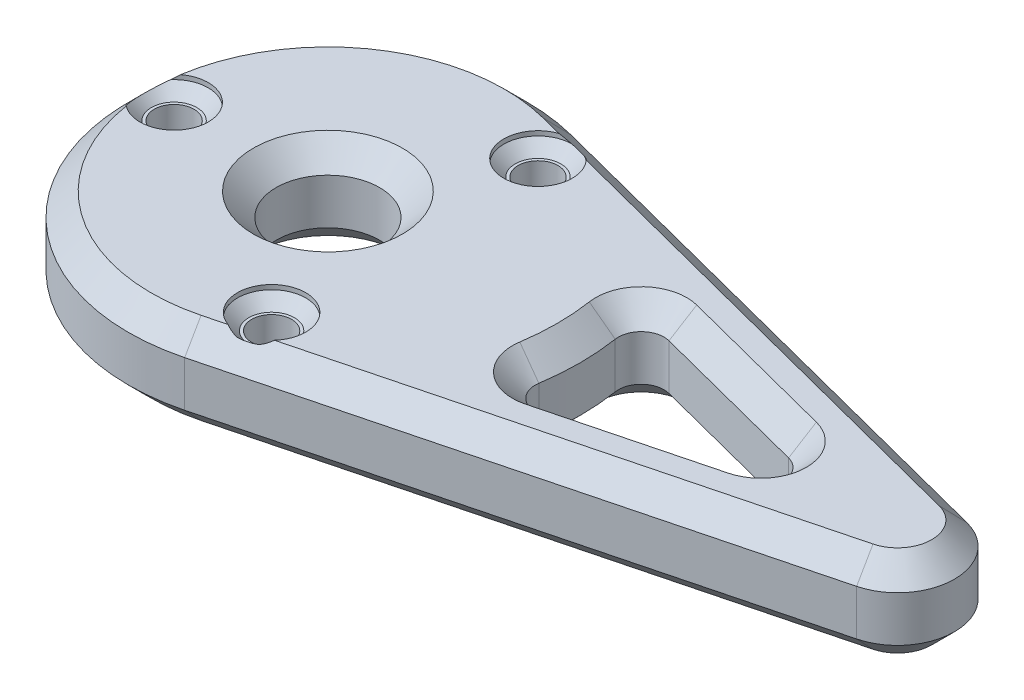
from build123d import *

# Parameters (mm, degrees)
SKETCH1_R           = 1.75
BOSS_EXTRUDE1_DEPTH = 8
SKETCH2_R           = 3
CUT_EXTRUDE1_DEPTH  = 1.4
CUT_EXTRUDE2_DEPTH  = 59.268773799
FILLET1_R           = 2
CHAMFER1_SIZE       = 1
SKETCH4_R           = 4.541609358
CUT_EXTRUDE3_DEPTH  = 59.268773799
CHAMFER2_SIZE       = 2


with BuildPart() as part:
    # Sketch1 → Boss-Extrude1 (new body)
    with BuildSketch(Plane(origin=(0, 0, 0), x_dir=(1, 0, 0), z_dir=(0, 1, 0))):
        with BuildLine():
            Line((4.375, 16.94430214), (51.25, 4.841229183))
            ThreePointArc((51.25, 4.841229183), (55, 0), (51.25, -4.841229183))
            Line((51.25, -4.841229183), (4.375, -16.94430214))
            ThreePointArc((4.375, -16.94430214), (-17.5, 0), (4.375, 16.94430214))
        make_face()
        with Locations(Location((6.75, 11.691342951, 0), (0, 0, 270))):
            Circle(SKETCH1_R, mode=Mode.SUBTRACT)
        with Locations(Location((-13.5, 0, 0), (0, 0, 270))):
            Circle(SKETCH1_R, mode=Mode.SUBTRACT)
        with Locations(Location((6.75, -11.691342951, 0), (0, 0, 270))):
            Circle(SKETCH1_R, mode=Mode.SUBTRACT)
    extrude(amount=BOSS_EXTRUDE1_DEPTH)

    # Sketch2 → Cut-Extrude1 (cut)
    with BuildSketch(Plane(origin=(0, 8, 0), x_dir=(1, 0, 0), z_dir=(0, 1, 0))):
        with Locations(Location((6.75, -11.691342951, 0), (0, 0, 270))):
            Circle(SKETCH2_R)
        with Locations(Location((6.75, 11.691342951, 0), (0, 0, 270))):
            Circle(SKETCH2_R)
        with Locations(Location((-13.5, 0, 0), (0, 0, 270))):
            Circle(SKETCH2_R)
    extrude(amount=-CUT_EXTRUDE1_DEPTH, mode=Mode.SUBTRACT)

    # Sketch3 → Cut-Extrude2 (cut, through all)
    with BuildSketch(Plane(origin=(0, 8, 0), x_dir=(1, 0, 0), z_dir=(0, 1, 0))):
        with BuildLine():
            Line((21.175820833, -6.4095755), (46, 0))
            Line((46, 0), (21.175820833, 6.4095755))
            ThreePointArc((21.175820833, 6.4095755), (22.124602732, 0), (21.175820833, -6.4095755))
        make_face()
    extrude(amount=-CUT_EXTRUDE2_DEPTH, mode=Mode.SUBTRACT)

    # Fillet1
    fillet1_edges = [part.edges().sort_by_distance(p)[0] for p in [
        (21.175820833, 4, 6.4095755),
        (21.175820833, 4, -6.4095755),
        (46, 4, 0),
    ]]
    fillet(fillet1_edges, radius=FILLET1_R)

    # Chamfer1
    chamfer1_edges = [part.edges().sort_by_distance(p)[0] for p in [
        (6.75, 6.6, 8.691342951),
        (6.75, 6.6, -14.691342951),
        (-13.5, 6.6, -3),
    ]]
    chamfer(chamfer1_edges, length=CHAMFER1_SIZE)

    # Sketch4 → Cut-Extrude3 (cut, through all)
    with BuildSketch(Plane(origin=(0, 8, 0), x_dir=(1, 0, 0), z_dir=(0, 1, 0))):
        with Locations(Location((0, 0, 0), (0, 0, 270))):
            Circle(SKETCH4_R)
    extrude(amount=-CUT_EXTRUDE3_DEPTH, mode=Mode.SUBTRACT)

    # Chamfer2
    # the kernel refuses this chamfer: 2 mm, written as the material it takes off along each edge
    with BuildSketch(Plane(origin=(38, 0, 0), x_dir=(0.25, 0, 0.9682458365518543), z_dir=(-0.9682458365518543, 0, 0.25))) as chamfer2_piece_1:
        Polygon((2 + CHAMFER2_SIZE, 0), (2, CHAMFER2_SIZE), (2, 0), align=None)
    revolve(axis=Axis((38, 0, 0), (0, 1, 0)), revolution_arc=151.044975628, mode=Mode.SUBTRACT)
    with BuildSketch(Plane(origin=(24.346197065, 0, -5.590987877), x_dir=(0.24990547922782413, -0.027495876610586372, -0.9678797591753465), z_dir=(0.9682458365518543, 0, 0.24999999999999997)), Plane(origin=(38.5, 0, 1.936491673), x_dir=(0.2499054792278243, -0.027495876610585942, 0.9678797591753466), z_dir=(-0.9682458365518543, 0, 0.2500000000000001)), Plane(origin=(38.5, 8, -1.936491673), x_dir=(0.24990547922782413, 0.027495876610586497, -0.9678797591753466), z_dir=(-0.9682458365518543, 0, -0.24999999999999997)), Plane(origin=(24.346197065, 8, 5.590987877), x_dir=(0.2499054792278243, 0.02749587661058648, 0.9678797591753466), z_dir=(0.9682458365518543, 0, -0.2500000000000001))) as chamfer2_piece_2:
        Polygon((CHAMFER2_SIZE * 0.999621916911, CHAMFER2_SIZE * 0.0274958766106), (-CHAMFER2_SIZE * 0.0274958766106, CHAMFER2_SIZE * 0.999621916911), (0, 0), align=None)
    extrude(amount=14.617984814, mode=Mode.SUBTRACT)
    with BuildSketch(Plane(origin=(23.846197065, 0, -3.654496203), x_dir=(-0.9884596787014585, 0, 0.15148420241533292), z_dir=(0.15148420241533292, 0, 0.9884596787014585))) as chamfer2_piece_3:
        Polygon((2 + CHAMFER2_SIZE, 0), (2, -CHAMFER2_SIZE), (2, 0), align=None)
    revolve(axis=Axis((23.846197065, 0, -3.654496203), (0, -1, 0)), revolution_arc=113.190460245, mode=Mode.SUBTRACT)
    with BuildSketch(Plane(origin=(23.846197065, 0, 3.654496203), x_dir=(0.25000000000000006, 0, 0.9682458365518543), z_dir=(0.9682458365518543, 0, -0.25000000000000006))) as chamfer2_piece_4:
        Polygon((2 + CHAMFER2_SIZE, 0), (2, -CHAMFER2_SIZE), (2, 0), align=None)
    revolve(axis=Axis((23.846197065, 0, 3.654496203), (0, -1, 0)), revolution_arc=113.190460245, mode=Mode.SUBTRACT)
    with BuildSketch(Plane(origin=(0, 0, 0), x_dir=(0.988459678701458, 0, 0.151484202415335), z_dir=(-0.151484202415335, 0, 0.988459678701458))) as chamfer2_piece_5:
        Polygon((22.124602732 - CHAMFER2_SIZE, 0), (22.124602732, CHAMFER2_SIZE), (22.124602732, 0), align=None)
    revolve(axis=Axis((0, 0, 0), (0, 1, 0)), revolution_arc=17.425896117, mode=Mode.SUBTRACT)
    with BuildSketch(Plane(origin=(23.846197065, 8, -3.654496203), x_dir=(-0.9884596787014583, 0, 0.15148420241533467), z_dir=(0.15148420241533467, 0, 0.9884596787014583))) as chamfer2_piece_6:
        Polygon((2 + CHAMFER2_SIZE, 0), (2, CHAMFER2_SIZE), (2, 0), align=None)
    revolve(axis=Axis((23.846197065, 8, -3.654496203), (0, -1, 0)), revolution_arc=113.190460245, mode=Mode.SUBTRACT)
    with BuildSketch(Plane(origin=(0, 8, 0), x_dir=(0.9884596787014582, 0, -0.1514842024153346), z_dir=(-0.1514842024153346, 0, -0.9884596787014582))) as chamfer2_piece_7:
        Polygon((22.124602732 - CHAMFER2_SIZE, 0), (22.124602732, CHAMFER2_SIZE), (22.124602732, 0), align=None)
    revolve(axis=Axis((0, 8, 0), (0, -1, 0)), revolution_arc=17.425896117, mode=Mode.SUBTRACT)
    with BuildSketch(Plane(origin=(23.846197065, 8, 3.654496203), x_dir=(0.25000000000000006, 0, 0.9682458365518543), z_dir=(0.9682458365518543, 0, -0.25000000000000006))) as chamfer2_piece_8:
        Polygon((2 + CHAMFER2_SIZE, 0), (2, CHAMFER2_SIZE), (2, 0), align=None)
    revolve(axis=Axis((23.846197065, 8, 3.654496203), (0, -1, 0)), revolution_arc=113.190460245, mode=Mode.SUBTRACT)
    with BuildSketch(Plane(origin=(38, 8, 0), x_dir=(0.25, 0, 0.9682458365518543), z_dir=(-0.9682458365518543, 0, 0.25))) as chamfer2_piece_9:
        Polygon((2 + CHAMFER2_SIZE, 0), (2, -CHAMFER2_SIZE), (2, 0), align=None)
    revolve(axis=Axis((38, 8, 0), (0, 1, 0)), revolution_arc=151.044975628, mode=Mode.SUBTRACT)
    with BuildSketch(Plane(origin=(4.375, 0, -16.94430214), x_dir=(-0.24990547922782413, -0.027495876610586365, 0.9678797591753465), z_dir=(0.9682458365518543, 0, 0.24999999999999997)), Plane(origin=(51.25, 0, 4.841229183), x_dir=(-0.2499054792278242, -0.027495876610586348, -0.9678797591753466), z_dir=(-0.9682458365518543, 0, 0.24999999999999997))) as chamfer2_piece_10:
        Polygon((CHAMFER2_SIZE * 0.999621916911, -CHAMFER2_SIZE * 0.0274958766106), (-CHAMFER2_SIZE * 0.0274958766106, -CHAMFER2_SIZE * 0.999621916911), (0, 0), align=None)
    extrude(amount=48.412291828, mode=Mode.SUBTRACT)
    with BuildSketch(Plane(origin=(0, 0, 0), x_dir=(0.24999999999999994, 0, 0.9682458365518543), z_dir=(0.9682458365518543, 0, -0.24999999999999994))) as chamfer2_piece_11:
        Polygon((17.5 - CHAMFER2_SIZE, 0), (17.5, -CHAMFER2_SIZE), (17.5, 0), align=None)
    revolve(axis=Axis((0, 0, 0), (0, -1, 0)), revolution_arc=208.955024372, mode=Mode.SUBTRACT)
    with BuildSketch(Plane(origin=(50, 0, 0), x_dir=(0.25000000000000105, 0, -0.9682458365518539), z_dir=(-0.9682458365518539, 0, -0.25000000000000105))) as chamfer2_piece_12:
        Polygon((5 - CHAMFER2_SIZE, 0), (5, -CHAMFER2_SIZE), (5, 0), align=None)
    revolve(axis=Axis((50, 0, 0), (0, -1, 0)), revolution_arc=151.044975628, mode=Mode.SUBTRACT)
    with BuildSketch(Plane(origin=(50, 8, 0), x_dir=(0.25000000000000105, 0, -0.9682458365518539), z_dir=(-0.9682458365518539, 0, -0.25000000000000105))) as chamfer2_piece_13:
        Polygon((5 - CHAMFER2_SIZE, 0), (5, CHAMFER2_SIZE), (5, 0), align=None)
    revolve(axis=Axis((50, 8, 0), (0, -1, 0)), revolution_arc=151.044975628, mode=Mode.SUBTRACT)
    with BuildSketch(Plane(origin=(0, 0, 0), x_dir=(0, 0, 1), z_dir=(-1, 0, 0))) as chamfer2_piece_14:
        Polygon((4.541609358 + CHAMFER2_SIZE, 0), (4.541609358, CHAMFER2_SIZE), (4.541609358, 0), align=None)
    revolve(axis=Axis((0, 0, 0), (0, 1, 0)), mode=Mode.SUBTRACT)
    with BuildSketch(Plane(origin=(0, 8, 0), x_dir=(0, 0, 1), z_dir=(-1, 0, 0))) as chamfer2_piece_15:
        Polygon((4.541609358 + CHAMFER2_SIZE, 0), (4.541609358, -CHAMFER2_SIZE), (4.541609358, 0), align=None)
    revolve(axis=Axis((0, 8, 0), (0, 1, 0)), mode=Mode.SUBTRACT)
    with BuildSketch(Plane(origin=(4.375, 8, -16.94430214), x_dir=(-0.24990547922782413, 0.02749587661058648, 0.9678797591753465), z_dir=(0.9682458365518543, 0, 0.24999999999999997)), Plane(origin=(51.25, 8, 4.841229183), x_dir=(-0.2499054792278242, 0.027495876610586473, -0.9678797591753466), z_dir=(-0.9682458365518543, 0, 0.24999999999999997))) as chamfer2_piece_16:
        Polygon((CHAMFER2_SIZE * 0.999621916911, CHAMFER2_SIZE * 0.0274958766106), (-CHAMFER2_SIZE * 0.0274958766106, CHAMFER2_SIZE * 0.999621916911), (0, 0), align=None)
    extrude(amount=48.412291828, mode=Mode.SUBTRACT)
    with BuildSketch(Plane(origin=(0, 8, 0), x_dir=(0.24999999999999994, 0, 0.9682458365518543), z_dir=(0.9682458365518543, 0, -0.24999999999999994))) as chamfer2_piece_17:
        Polygon((17.5 - CHAMFER2_SIZE, 0), (17.5, CHAMFER2_SIZE), (17.5, 0), align=None)
    revolve(axis=Axis((0, 8, 0), (0, -1, 0)), revolution_arc=208.955024372, mode=Mode.SUBTRACT)


solid = part.part
